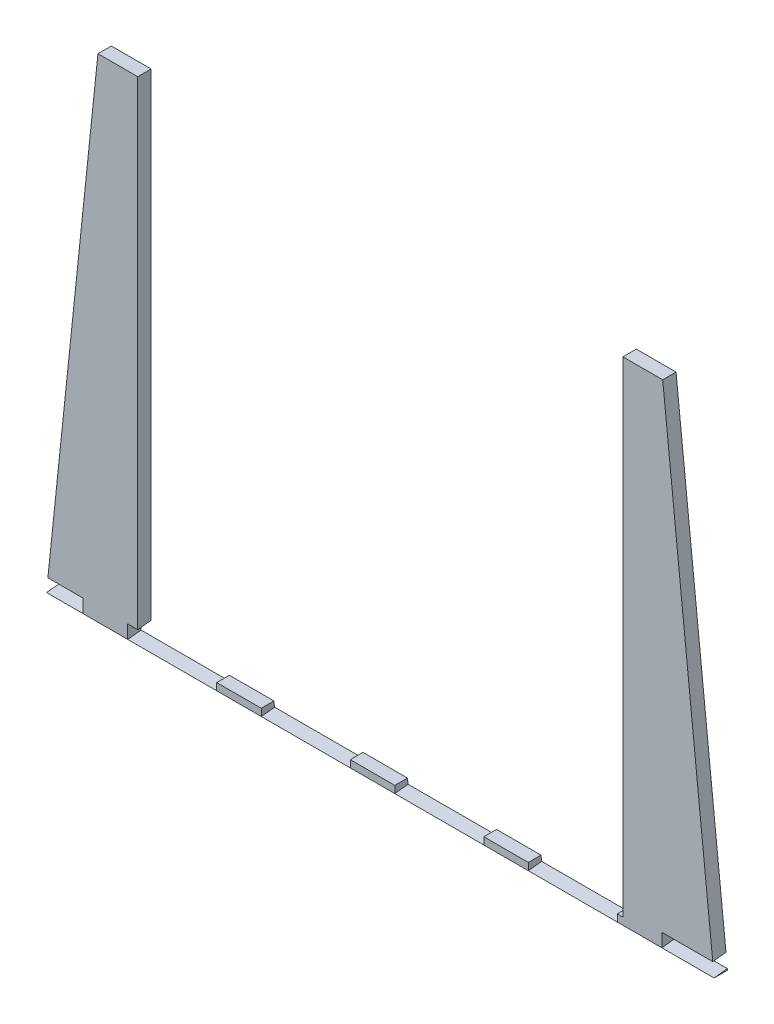
from build123d import *

# Parameters (mm, degrees)
BOSS_EXTRUDE1_DEPTH = 3
CAVITY1_START       = -3.803030659
CAVITY1_OUTLINE_W   = 20
CAVITY1_OUTLINE_H   = 3
CAVITY1_OUTLINE_W_2 = 12.749963879
CAVITY1_OUTLINE_W_3 = 9.250036121
CAVITY1_DEPTH       = 3.331837545
CAVITY1_START_2     = -0.803030659
CAVITY1_2_OUTLINE_W = 10
CAVITY1_2_OUTLINE_H = 3
CAVITY1_2_DEPTH     = 0.331837545


# Read off the part's stored shape, not the designer's step: Cavity1
with BuildPart() as part:
    # Sketch3 → Boss-Extrude1 (new body)
    with BuildSketch(Plane.XY):
        Polygon((-63.438534121, 102.766276007), (-75, -7.839634745), (75, -7.839634745), (63.438534121, 102.766276007), (54.5, 102.766276007), (54.5, -6.233723993), (-54.5, -6.233723993), (-54.5, 102.766276007), align=None)
    extrude(amount=BOSS_EXTRUDE1_DEPTH)

    # Cavity1 outline → Cavity1 (cut)
    with BuildSketch(Plane(origin=(0, 0, 0), x_dir=(1, 0, 0), z_dir=(0, 0.10452846326765304, -0.9945218953682734)).offset(CAVITY1_START)):
        with Locations((43.250036121, 5.983103016)):
            Rectangle(CAVITY1_OUTLINE_W, CAVITY1_OUTLINE_H)
        with Locations((13.250036121, 5.983103016)):
            Rectangle(CAVITY1_OUTLINE_W, CAVITY1_OUTLINE_H)
        with Locations((69.62501806, 5.983103016)):
            Rectangle(CAVITY1_OUTLINE_W_2, CAVITY1_OUTLINE_H)
        with Locations((-16.749963879, 5.983103016)):
            Rectangle(CAVITY1_OUTLINE_W, CAVITY1_OUTLINE_H)
        with Locations((-46.749963879, 5.983103016)):
            Rectangle(CAVITY1_OUTLINE_W, CAVITY1_OUTLINE_H)
        with Locations((-71.37498194, 5.983103016)):
            Rectangle(CAVITY1_OUTLINE_W_3, CAVITY1_OUTLINE_H)
    extrude(amount=CAVITY1_DEPTH, mode=Mode.SUBTRACT)

    # Cavity1 2 outline → Cavity1 2 (cut)
    with BuildSketch(Plane(origin=(0, 0, 0), x_dir=(1, 0, 0), z_dir=(0, 0.10452846326765304, -0.9945218953682734)).offset(CAVITY1_START_2)):
        with Locations((28.250036121, 5.983103016)):
            Rectangle(CAVITY1_2_OUTLINE_W, CAVITY1_2_OUTLINE_H)
        with Locations((58.250036121, 5.983103016)):
            Rectangle(CAVITY1_2_OUTLINE_W, CAVITY1_2_OUTLINE_H)
        with Locations((-1.749963879, 5.983103016)):
            Rectangle(CAVITY1_2_OUTLINE_W, CAVITY1_2_OUTLINE_H)
        with Locations((-31.749963879, 5.983103016)):
            Rectangle(CAVITY1_2_OUTLINE_W, CAVITY1_2_OUTLINE_H)
        with Locations((-61.749963879, 5.983103016)):
            Rectangle(CAVITY1_2_OUTLINE_W, CAVITY1_2_OUTLINE_H)
    extrude(amount=CAVITY1_2_DEPTH, mode=Mode.SUBTRACT)


solid = part.part
